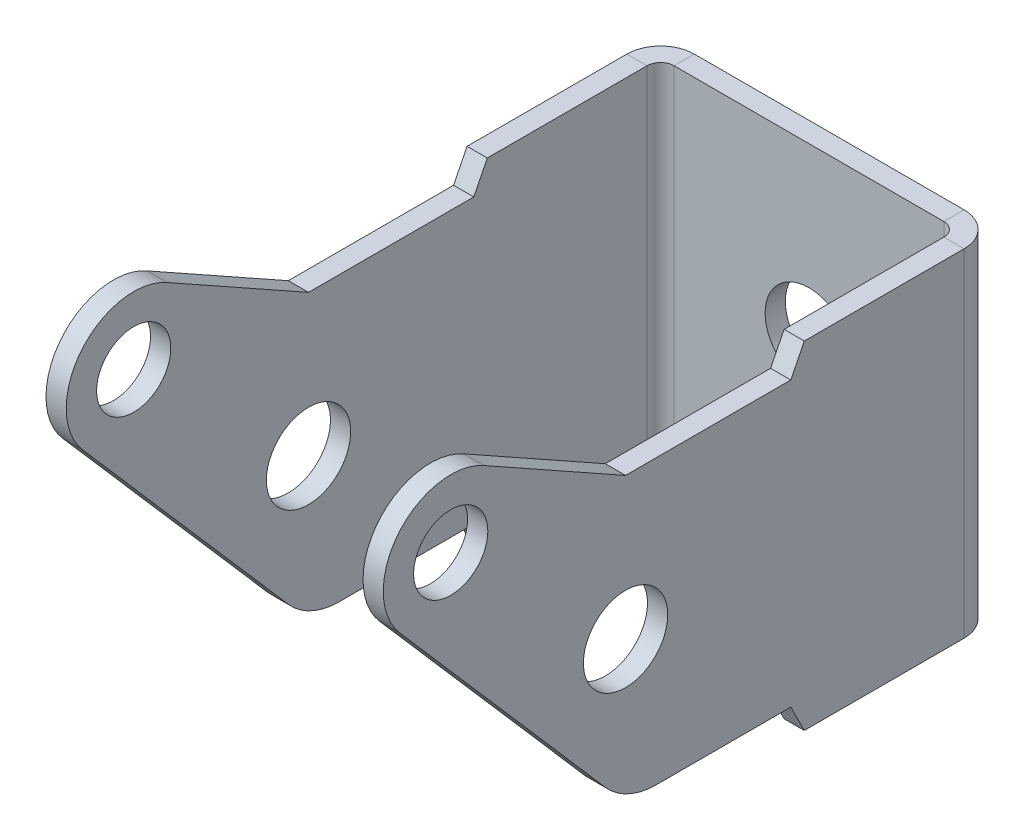
from build123d import *

# Parameters (mm, degrees)
SKETCH1_W                    = 50
SKETCH1_H                    = 50
BASE_FLANGE2_DEPTH           = 3
EDGE_FLANGE1_STRIP_W         = 16
EDGE_FLANGE1_STRIP_H         = 3
EDGE_FLANGE1_STRIP_CUT_DEPTH = 50
EDGE_FLANGE1_DEPTH           = 50
EDGE_FLANGE1_PROFILE_R       = 6.25
EDGE_FLANGE1_PROFILE_R_2     = 5.5
EDGE_FLANGE1_FLAT_DEPTH      = 3
SKETCH22_R                   = 6.5
CUT_EXTRUDE1_DEPTH           = 10


# Sheet-metal steps are written as plain solids
with BuildPart() as part:
    # Sketch1 → Base-Flange2 (new body)
    with BuildSketch(Plane.XY):
        Rectangle(SKETCH1_W, SKETCH1_H)
    extrude(amount=-BASE_FLANGE2_DEPTH)

    # Edge-Flange1 strip (across the edge) → Edge-Flange1 strip cut (cut)
    with BuildSketch(Plane(origin=(25, -25, 0), x_dir=(-1, 0, 0), z_dir=(0, 1, 0))):
        with Locations((-3, -1.5)):
            Rectangle(EDGE_FLANGE1_STRIP_W, EDGE_FLANGE1_STRIP_H)
    edge_flange1_strip_cut = extrude(amount=EDGE_FLANGE1_STRIP_CUT_DEPTH, mode=Mode.SUBTRACT)

    # Edge-Flange1 bend section (across the edge) → Edge-Flange1 (add)
    with BuildSketch(Plane(origin=(25, -25, 0), x_dir=(-1, 0, 0), z_dir=(0, 1, 0))):
        with BuildLine():
            Line((0, 2), (3, 2))
            ThreePointArc((3, 2), (3.585786438, 0.585786438), (5, 0))
            Line((5, 0), (5, -3))
            ThreePointArc((5, -3), (1.464466094, -1.535533906), (0, 2))
        make_face()
    edge_flange1 = extrude(amount=EDGE_FLANGE1_DEPTH)

    # Edge-Flange1 profile (on flange) → Edge-Flange1 flat (add)
    with BuildSketch(Plane.YZ.offset(25)):
        with BuildLine():
            ThreePointArc((32.731549172, 73.12961498), (30.399526878, 85.843718314), (17.474995057, 85.635802941))
            Line((17.474995057, 85.635802941), (-17.56059029, 55.179833247))
            ThreePointArc((-17.56059029, 55.179833247), (-20.099612709, 51.779669871), (-21, 47.632737445))
            Line((-21, 47.632737445), (-21, 27.69))
            Line((-21, 27.69), (-25, 25.69))
            Line((-25, 25.69), (-25, 2))
            Line((-25, 2), (25, 2))
            Line((25, 2), (25, 25.69))
            Line((25, 25.69), (21, 27.69))
            Line((21, 27.69), (21, 52.19))
            Line((21, 52.19), (32.731549172, 73.12961498))
        make_face()
        with Locations((0, 52.19)):
            Circle(EDGE_FLANGE1_PROFILE_R, mode=Mode.SUBTRACT)
        with Locations((24.06, 78.11)):
            Circle(EDGE_FLANGE1_PROFILE_R_2, mode=Mode.SUBTRACT)
    edge_flange1_flat = extrude(amount=-EDGE_FLANGE1_FLAT_DEPTH)

    # Mirror1: Edge-Flange1 strip cut, Edge-Flange1, Edge-Flange1 flat across plane
    add(edge_flange1_strip_cut.mirror(Plane(origin=(0, 0, 0), x_dir=(0, 0, 1), z_dir=(1, 0, 0))), mode=Mode.SUBTRACT)
    add(edge_flange1.mirror(Plane(origin=(0, 0, 0), x_dir=(0, 0, 1), z_dir=(1, 0, 0))))
    add(edge_flange1_flat.mirror(Plane(origin=(0, 0, 0), x_dir=(0, 0, 1), z_dir=(1, 0, 0))))

    # Sketch22 → Cut-Extrude1 (cut)
    with BuildSketch(Plane(origin=(0, 0, -3), x_dir=(-1, 0, 0), z_dir=(0, 0, -1))):
        Circle(SKETCH22_R)
    extrude(amount=-CUT_EXTRUDE1_DEPTH, mode=Mode.SUBTRACT)


solid = part.part
